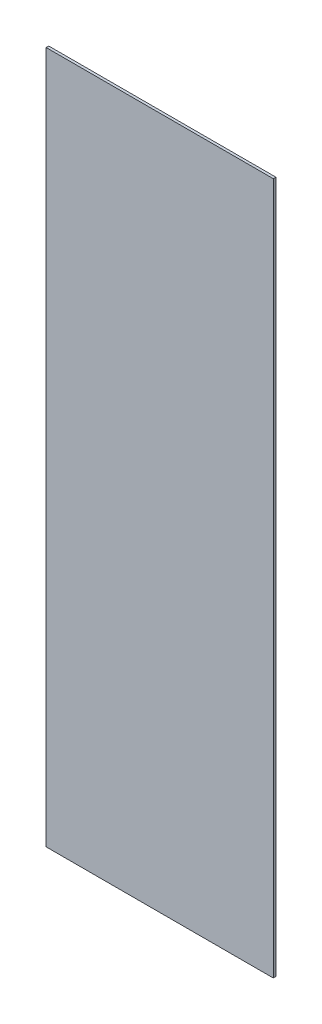
from build123d import *

# Parameters (mm, degrees)
SKETCH1_W           = 200
SKETCH1_H           = 609.6
BOSS_EXTRUDE1_DEPTH = 2.305


with BuildPart() as part:
    # Sketch1 → Boss-Extrude1 (new body)
    with BuildSketch(Plane.XY):
        Rectangle(SKETCH1_W, SKETCH1_H)
    extrude(amount=BOSS_EXTRUDE1_DEPTH)


solid = part.part
